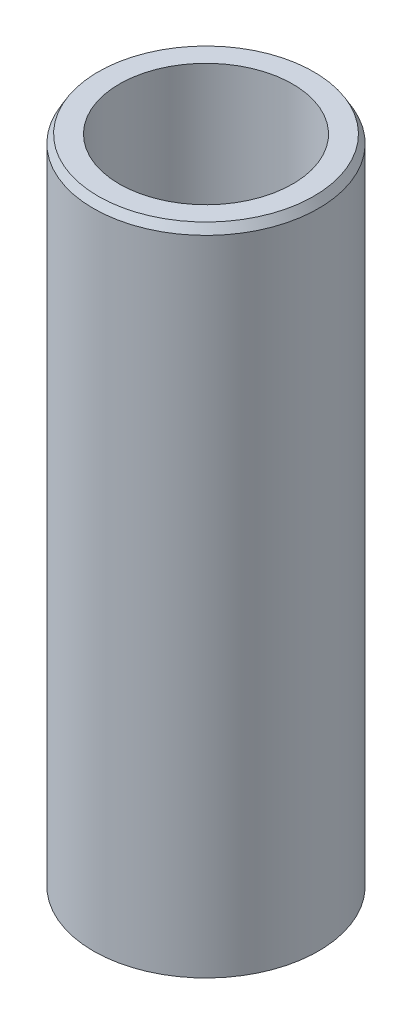
from build123d import *
from OCP.BRepFilletAPI import BRepFilletAPI_MakeChamfer

# Parameters (mm, degrees)
SKETCH1_R           = 50
BOSS_EXTRUDE1_DEPTH = 291.458288384
SKETCH2_R           = 38.498347983
CUT_EXTRUDE1_DEPTH  = 300.913210559
CHAMFER1_SIZE       = 3.657237863
CHAMFER1_SIZE2      = 2.111507265


with BuildPart() as part:
    # Sketch1 → Boss-Extrude1 (new body)
    with BuildSketch(Plane(origin=(0, 0, 0), x_dir=(1, 0, 0), z_dir=(0, 1, 0))):
        Circle(SKETCH1_R)
    extrude(amount=BOSS_EXTRUDE1_DEPTH)

    # Sketch2 → Cut-Extrude1 (cut, through all)
    with BuildSketch(Plane(origin=(0, 0, 0), x_dir=(1, 0, 0), z_dir=(0, 1, 0))):
        Circle(SKETCH2_R)
    extrude(amount=CUT_EXTRUDE1_DEPTH, mode=Mode.SUBTRACT)

    # Chamfer1: one chamfer whose edges measure the first distance from different faces: ONE call of the kernel's chamfer builder (chamfer() names one face for all edges)
    chamfer1_edges_1 = [part.edges().sort_by_distance(p)[0] for p in [
        (-50, 291.458288384, 0),
    ]]
    chamfer1_side_1 = [part.faces().sort_by_distance(p)[0] for p in [
        (-50, 145.729144192, 0),
    ]]
    chamfer1_edges_2 = [part.edges().sort_by_distance(p)[0] for p in [
        (-50, 0, 0),
    ]]
    chamfer1_side_2 = [part.faces().sort_by_distance(p)[0] for p in [
        (-48.585786438, 0, 0),
    ]]
    chamfer1 = BRepFilletAPI_MakeChamfer(part.part.solid().wrapped)
    for e in chamfer1_edges_1:
        chamfer1.Add(CHAMFER1_SIZE, CHAMFER1_SIZE2, e.wrapped, chamfer1_side_1[0].wrapped)  # the first distance lies on this face
    for e in chamfer1_edges_2:
        chamfer1.Add(CHAMFER1_SIZE, CHAMFER1_SIZE2, e.wrapped, chamfer1_side_2[0].wrapped)  # the first distance lies on this face
    add(Compound.cast(chamfer1.Shape()), mode=Mode.REPLACE)


solid = part.part
